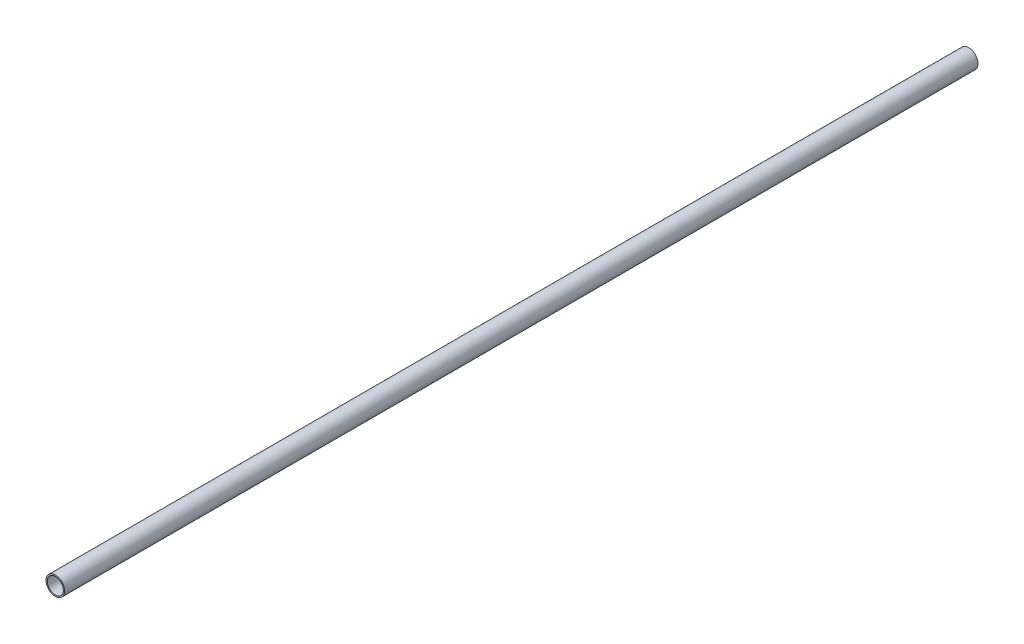
from build123d import *

# Parameters (mm, degrees)
SKETCH2_R           = 5.5245
SKETCH2_R_2         = 4.7625
BOSS_EXTRUDE1_DEPTH = 542.88963304


with BuildPart() as part:
    # Sketch2 → Boss-Extrude1 (new body)
    with BuildSketch(Plane(origin=(-549.704008553, -1576.7432843, 0), x_dir=(0.7832549151199641, -0.6217006819526723, 0), z_dir=(0, 0, -1))):
        with Locations((-549.704008553, -1576.7432843)):
            Circle(SKETCH2_R)
        with Locations((-549.704008553, -1576.7432843)):
            Circle(SKETCH2_R_2, mode=Mode.SUBTRACT)
    extrude(amount=BOSS_EXTRUDE1_DEPTH)


solid = part.part
